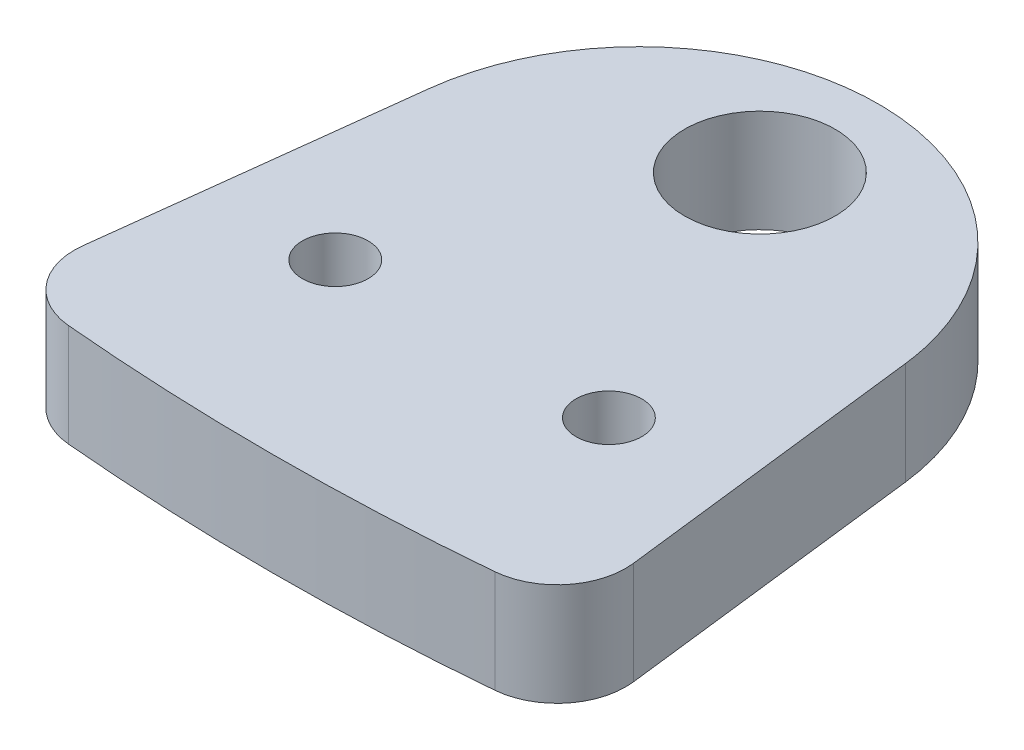
from build123d import *

# Parameters (mm, degrees)
SKETCH1_R            = 5.5
BOSS_EXTRUDE1_DEPTH  = 7.5
FILLET1_START        = -1
FILLET1_DEPTH        = 9
M4_CLEARANCE_HOLE1_D = 4.8
FILLET2_R            = 5


with BuildPart() as part:
    # Sketch1 → Boss-Extrude1 (new body)
    with BuildSketch(Plane(origin=(0, 0, 0), x_dir=(1, 0, 0), z_dir=(0, 1, 0))):
        with BuildLine():
            Line((-17.306036515, 15.320071712), (-20.703818553, -13.05219824))
            ThreePointArc((-20.703818553, -13.05219824), (0, -14.2875), (20.703818553, -13.05219824))
            Line((20.703818553, -13.05219824), (17.306036515, 15.320071712))
            Line((17.306036515, 15.320071712), (15.436394314, 30.932018749))
            ThreePointArc((15.436394314, 30.932018749), (0, 30.011), (-15.436394314, 30.932018749))
            Line((-15.436394314, 30.932018749), (-17.306036515, 15.320071712))
        make_face()
        with Locations(Location((0, 21.336, 0), (0, 0, 270))):
            Circle(SKETCH1_R, mode=Mode.SUBTRACT)
    extrude(amount=BOSS_EXTRUDE1_DEPTH)

    # Fillet1: read off the stored shape, not the designer's step
    # Fillet1 outline → Fillet1 (cut)
    with BuildSketch(Plane(origin=(0, 0, 0), x_dir=(1, 0, 0), z_dir=(0, 1, 0)).offset(FILLET1_START)):
        with BuildLine():
            Line((-15.436394314, 30.932018749), (-17.395311398, 14.574605686))
            add(Edge.make_bspline(
                [(-17.395311398, 14.574605686), (-16.419132346, 22.72592771), (-10.364461962, 30.010999958), (-7.1e-08, 30.011)],
                knots=[0, 0, 0, 0, 0.499999999, 0.499999999, 0.499999999, 0.499999999], degree=3, weights=[1, 0.706302503, 0.559453755, 0.559453754]))
            ThreePointArc((-7.1e-08, 30.011), (-7.731923227, 30.24145925), (-15.436394314, 30.932018749))
        make_face()
        with BuildLine():
            ThreePointArc((15.436394314, 30.932018749), (7.731923156, 30.241459246), (-7.1e-08, 30.011))
            add(Edge.make_bspline(
                [(-7.1e-08, 30.011), (10.364461892, 30.011000042), (16.41913234, 22.725927763), (17.395311398, 14.574605686)],
                knots=[0.499999999, 0.499999999, 0.499999999, 0.499999999, 1, 1, 1, 1], degree=3, weights=[0.559453754, 0.559453753, 0.706302502, 1]))
            Line((17.395311398, 14.574605686), (15.436394314, 30.932018749))
        make_face()
    extrude(amount=FILLET1_DEPTH, mode=Mode.SUBTRACT)

    # M4 Clearance Hole1 (through all)
    with Locations(Plane(origin=(0, 7.5, 0), x_dir=(1, 0, 0), z_dir=(0, 1, 0))):
        with Locations((-9.993476963, 0.312731325), (9.993476963, 0.312731325)):
            Hole(M4_CLEARANCE_HOLE1_D / 2)

    # Fillet2
    fillet2_edges = [part.edges().sort_by_distance(p)[0] for p in [
        (20.703818553, 3.75, 13.05219824),
        (-20.703818553, 3.75, 13.05219824),
    ]]
    fillet(fillet2_edges, radius=FILLET2_R)


solid = part.part
